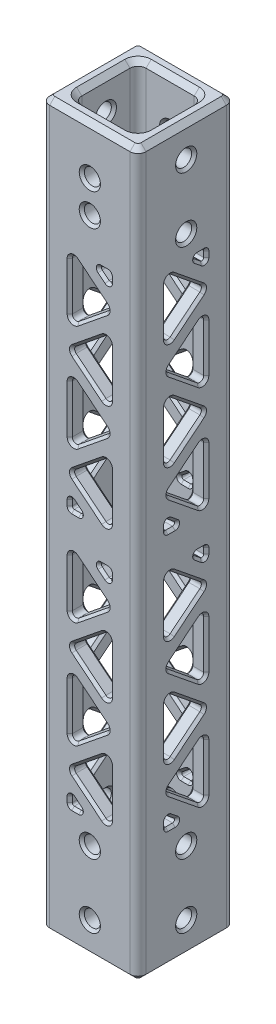
from build123d import *

# Parameters (mm, degrees)
SKETCH1_W                    = 19.05
SKETCH1_H                    = 19.05
SKETCH1_W_2                  = 12.7
SKETCH1_H_2                  = 12.7
BOSS_EXTRUDE1_DEPTH          = 71.4375
F_1_8_0_125_DIAMETER_HOLE1_D = 3.175
F_1_8_0_125_DIAMETER_HOLE2_D = 3.175
F_1_8_0_125_DIAMETER_HOLE3_D = 3.175
CUT_EXTRUDE1_REACH           = 74.696
CIRPATTERN1_COUNT            = 4
FILLET1_R                    = 1.5875
FILLET2_R                    = 0.79375
FILLET3_R                    = 0.396875
CHAMFER1_SIZE                = 1.016
CHAMFER2_SIZE                = 0.508


with BuildPart() as part:
    # Sketch1 → Boss-Extrude1 (new, symmetric)
    with BuildSketch(Plane(origin=(0, 0, 0), x_dir=(1, 0, 0), z_dir=(0, 1, 0))):
        Rectangle(SKETCH1_W, SKETCH1_H)
        Rectangle(SKETCH1_W_2, SKETCH1_H_2, mode=Mode.SUBTRACT)
    extrude(amount=BOSS_EXTRUDE1_DEPTH, both=True)

    # 1/8 (0.125) Diameter Hole1 (through all)
    with Locations(Plane.ZY.offset(9.525)):
        with Locations((0, 65.0875), (0, 52.3875)):
            Hole(F_1_8_0_125_DIAMETER_HOLE1_D / 2)

    # 1/8 (0.125) Diameter Hole2 (through all)
    with Locations(Plane(origin=(9.525, 0, 0), x_dir=(0, 0, -1), z_dir=(1, 0, 0))):
        with Locations((0, -52.3875), (0, -65.0875)):
            Hole(F_1_8_0_125_DIAMETER_HOLE2_D / 2)

    # 1/8 (0.125) Diameter Hole3 (through all)
    with Locations(Plane.XY.offset(9.525)):
        with Locations((0, 61.9125), (0, 55.5625), (0, -65.0875), (0, -52.3875)):
            Hole(F_1_8_0_125_DIAMETER_HOLE3_D / 2)

    # Sketch14 → Cut-Extrude1 (cut, up to next)
    with BuildSketch(Plane(origin=(0, 0, 0), x_dir=(0, 0, -1), z_dir=(1, 0, 0)), mode=Mode.PRIVATE) as cut_extrude1_sk1:
        Polygon((-3.96875, -30.66257637), (3.96875, -24.225305482), (3.96875, -37.099847259), align=None)
    cut_extrude1_tool1 = extrude(cut_extrude1_sk1.sketch, amount=-CUT_EXTRUDE1_REACH, mode=Mode.PRIVATE) & part.part
    # Sketch14 → Cut-Extrude1 (cut, up to next)
    with BuildSketch(Plane(origin=(0, 0, 0), x_dir=(0, 0, -1), z_dir=(1, 0, 0)), mode=Mode.PRIVATE) as cut_extrude1_sk2:
        Polygon((-3.96875, 47.625), (-1.071827407, 47.625), (-3.96875, 45.275610964), align=None)
    cut_extrude1_tool2 = extrude(cut_extrude1_sk2.sketch, amount=-CUT_EXTRUDE1_REACH, mode=Mode.PRIVATE) & part.part
    # Sketch14 → Cut-Extrude1 (cut, up to next)
    with BuildSketch(Plane(origin=(0, 0, 0), x_dir=(0, 0, -1), z_dir=(1, 0, 0)), mode=Mode.PRIVATE) as cut_extrude1_sk3:
        Polygon((3.96875, 47.625), (-3.96875, 41.187729111), (3.96875, 34.750458223), align=None)
    cut_extrude1_tool3 = extrude(cut_extrude1_sk3.sketch, amount=-CUT_EXTRUDE1_REACH, mode=Mode.PRIVATE) & part.part
    # Sketch14 → Cut-Extrude1 (cut, up to next)
    with BuildSketch(Plane(origin=(0, 0, 0), x_dir=(0, 0, -1), z_dir=(1, 0, 0)), mode=Mode.PRIVATE) as cut_extrude1_sk4:
        Polygon((-3.96875, 37.099847259), (3.96875, 30.66257637), (-3.96875, 24.225305482), align=None)
    cut_extrude1_tool4 = extrude(cut_extrude1_sk4.sketch, amount=-CUT_EXTRUDE1_REACH, mode=Mode.PRIVATE) & part.part
    # Sketch14 → Cut-Extrude1 (cut, up to next)
    with BuildSketch(Plane(origin=(0, 0, 0), x_dir=(0, 0, -1), z_dir=(1, 0, 0)), mode=Mode.PRIVATE) as cut_extrude1_sk5:
        Polygon((3.96875, 26.574694518), (-3.96875, 20.13742363), (3.96875, 13.700152741), align=None)
    cut_extrude1_tool5 = extrude(cut_extrude1_sk5.sketch, amount=-CUT_EXTRUDE1_REACH, mode=Mode.PRIVATE) & part.part
    # Sketch14 → Cut-Extrude1 (cut, up to next)
    with BuildSketch(Plane(origin=(0, 0, 0), x_dir=(0, 0, -1), z_dir=(1, 0, 0)), mode=Mode.PRIVATE) as cut_extrude1_sk6:
        Polygon((-3.96875, 3.175), (3.96875, 9.612270889), (-3.96875, 16.049541777), align=None)
    cut_extrude1_tool6 = extrude(cut_extrude1_sk6.sketch, amount=-CUT_EXTRUDE1_REACH, mode=Mode.PRIVATE) & part.part
    # Sketch14 → Cut-Extrude1 (cut, up to next)
    with BuildSketch(Plane(origin=(0, 0, 0), x_dir=(0, 0, -1), z_dir=(1, 0, 0)), mode=Mode.PRIVATE) as cut_extrude1_sk7:
        Polygon((1.071827407, 3.175), (3.96875, 3.175), (3.96875, 5.524389036), align=None)
    cut_extrude1_tool7 = extrude(cut_extrude1_sk7.sketch, amount=-CUT_EXTRUDE1_REACH, mode=Mode.PRIVATE) & part.part
    # Sketch14 → Cut-Extrude1 (cut, up to next)
    with BuildSketch(Plane(origin=(0, 0, 0), x_dir=(0, 0, -1), z_dir=(1, 0, 0)), mode=Mode.PRIVATE) as cut_extrude1_sk8:
        Polygon((-1.071827407, -3.175), (-3.96875, -3.175), (-3.96875, -5.524389036), align=None)
    cut_extrude1_tool8 = extrude(cut_extrude1_sk8.sketch, amount=-CUT_EXTRUDE1_REACH, mode=Mode.PRIVATE) & part.part
    # Sketch14 → Cut-Extrude1 (cut, up to next)
    with BuildSketch(Plane(origin=(0, 0, 0), x_dir=(0, 0, -1), z_dir=(1, 0, 0)), mode=Mode.PRIVATE) as cut_extrude1_sk9:
        Polygon((3.96875, -3.175), (-3.96875, -9.612270889), (3.96875, -16.049541777), align=None)
    cut_extrude1_tool9 = extrude(cut_extrude1_sk9.sketch, amount=-CUT_EXTRUDE1_REACH, mode=Mode.PRIVATE) & part.part
    # Sketch14 → Cut-Extrude1 (cut, up to next)
    with BuildSketch(Plane(origin=(0, 0, 0), x_dir=(0, 0, -1), z_dir=(1, 0, 0)), mode=Mode.PRIVATE) as cut_extrude1_sk10:
        Polygon((-3.96875, -13.700152741), (3.96875, -20.13742363), (-3.96875, -26.574694518), align=None)
    cut_extrude1_tool10 = extrude(cut_extrude1_sk10.sketch, amount=-CUT_EXTRUDE1_REACH, mode=Mode.PRIVATE) & part.part
    # Sketch14 → Cut-Extrude1 (cut, up to next)
    with BuildSketch(Plane(origin=(0, 0, 0), x_dir=(0, 0, -1), z_dir=(1, 0, 0)), mode=Mode.PRIVATE) as cut_extrude1_sk11:
        Polygon((-3.96875, -47.625), (3.96875, -41.187729111), (-3.96875, -34.750458223), align=None)
    cut_extrude1_tool11 = extrude(cut_extrude1_sk11.sketch, amount=-CUT_EXTRUDE1_REACH, mode=Mode.PRIVATE) & part.part
    # Sketch14 → Cut-Extrude1 (cut, up to next)
    with BuildSketch(Plane(origin=(0, 0, 0), x_dir=(0, 0, -1), z_dir=(1, 0, 0)), mode=Mode.PRIVATE) as cut_extrude1_sk12:
        Polygon((1.071827407, -47.625), (3.96875, -47.625), (3.96875, -45.275610964), align=None)
    cut_extrude1_tool12 = extrude(cut_extrude1_sk12.sketch, amount=-CUT_EXTRUDE1_REACH, mode=Mode.PRIVATE) & part.part
    cut_extrude1_1 = cut_extrude1_tool1.solids().sort_by_distance((0, -30.662576, -1.322917))[0]
    add(cut_extrude1_1, mode=Mode.SUBTRACT)
    cut_extrude1_2 = cut_extrude1_tool2.solids().sort_by_distance((0, 46.84187, 3.003109))[0]
    add(cut_extrude1_2, mode=Mode.SUBTRACT)
    cut_extrude1_3 = cut_extrude1_tool3.solids().sort_by_distance((0, 41.187729, -1.322917))[0]
    add(cut_extrude1_3, mode=Mode.SUBTRACT)
    cut_extrude1_4 = cut_extrude1_tool4.solids().sort_by_distance((0, 30.662576, 1.322917))[0]
    add(cut_extrude1_4, mode=Mode.SUBTRACT)
    cut_extrude1_5 = cut_extrude1_tool5.solids().sort_by_distance((0, 20.137424, -1.322917))[0]
    add(cut_extrude1_5, mode=Mode.SUBTRACT)
    cut_extrude1_6 = cut_extrude1_tool6.solids().sort_by_distance((0, 9.612271, 1.322917))[0]
    add(cut_extrude1_6, mode=Mode.SUBTRACT)
    cut_extrude1_7 = cut_extrude1_tool7.solids().sort_by_distance((0, 3.95813, -3.003109))[0]
    add(cut_extrude1_7, mode=Mode.SUBTRACT)
    cut_extrude1_8 = cut_extrude1_tool8.solids().sort_by_distance((0, -3.95813, 3.003109))[0]
    add(cut_extrude1_8, mode=Mode.SUBTRACT)
    cut_extrude1_9 = cut_extrude1_tool9.solids().sort_by_distance((0, -9.612271, -1.322917))[0]
    add(cut_extrude1_9, mode=Mode.SUBTRACT)
    cut_extrude1_10 = cut_extrude1_tool10.solids().sort_by_distance((0, -20.137424, 1.322917))[0]
    add(cut_extrude1_10, mode=Mode.SUBTRACT)
    cut_extrude1_11 = cut_extrude1_tool11.solids().sort_by_distance((0, -41.187729, 1.322917))[0]
    add(cut_extrude1_11, mode=Mode.SUBTRACT)
    cut_extrude1_12 = cut_extrude1_tool12.solids().sort_by_distance((0, -46.84187, -3.003109))[0]
    add(cut_extrude1_12, mode=Mode.SUBTRACT)
    cut_extrude1 = cut_extrude1_1 + cut_extrude1_2 + cut_extrude1_3 + cut_extrude1_4 + cut_extrude1_5 + cut_extrude1_6 + cut_extrude1_7 + cut_extrude1_8 + cut_extrude1_9 + cut_extrude1_10 + cut_extrude1_11 + cut_extrude1_12  # Cut-Extrude1 as one shape, for the pattern or mirror that repeats it

    # CirPattern1: Cut-Extrude1 ×4 about axis
    cirpattern1_axis = Axis((0, 0, 0), (0, 1, 0))
    for i in range(1, CIRPATTERN1_COUNT):
        add(cut_extrude1.rotate(cirpattern1_axis, i * 360 / CIRPATTERN1_COUNT), mode=Mode.SUBTRACT)

    # Fillet1
    fillet1_edges = [part.edges().sort_by_distance(p)[0] for p in [
        (6.35, 0, 6.35),
        (6.35, 0, -6.35),
        (-6.35, 0, -6.35),
        (-6.35, 0, 6.35),
        (9.525, 0, 9.525),
        (-9.525, 0, 9.525),
        (-9.525, 0, -9.525),
        (9.525, 0, -9.525),
    ]]
    fillet(fillet1_edges, radius=FILLET1_R)

    # Fillet2
    fillet2_edges = [part.edges().sort_by_distance(p)[0] for p in [
        (-7.9375, -3.175, -3.96875),
        (-7.9375, -16.049541777, -3.96875),
        (-7.9375, -9.612270889, 3.96875),
        (-7.9375, 3.175, 3.96875),
        (-7.9375, 16.049541777, 3.96875),
        (-7.9375, 9.612270889, -3.96875),
        (-7.9375, 47.625, -3.96875),
        (-7.9375, 34.750458223, -3.96875),
        (-7.9375, 41.187729111, 3.96875),
        (-7.9375, -37.099847259, -3.96875),
        (-7.9375, -30.66257637, 3.96875),
        (-7.9375, -24.225305482, -3.96875),
        (-7.9375, -47.625, 3.96875),
        (-7.9375, -34.750458223, 3.96875),
        (-7.9375, -41.187729111, -3.96875),
        (-7.9375, 26.574694518, -3.96875),
        (-7.9375, 13.700152741, -3.96875),
        (-7.9375, 20.13742363, 3.96875),
        (-7.9375, 24.225305482, 3.96875),
        (-7.9375, 37.099847259, 3.96875),
        (-7.9375, 30.66257637, -3.96875),
        (-7.9375, -26.574694518, 3.96875),
        (-7.9375, -13.700152741, 3.96875),
        (-7.9375, -20.13742363, -3.96875),
        (7.9375, 26.574694518, 3.96875),
        (7.9375, 13.700152741, 3.96875),
        (7.9375, 20.13742363, -3.96875),
        (7.9375, 24.225305482, -3.96875),
        (7.9375, 37.099847259, -3.96875),
        (7.9375, 30.66257637, 3.96875),
        (7.9375, -26.574694518, -3.96875),
        (7.9375, -13.700152741, -3.96875),
        (7.9375, -20.13742363, 3.96875),
        (7.9375, -3.175, 3.96875),
        (7.9375, -16.049541777, 3.96875),
        (7.9375, -9.612270889, -3.96875),
        (7.9375, 3.175, -3.96875),
        (7.9375, 16.049541777, -3.96875),
        (7.9375, 9.612270889, 3.96875),
        (3.96875, -3.175, -7.9375),
        (3.96875, -16.049541777, -7.9375),
        (-3.96875, -9.612270889, -7.9375),
        (-3.96875, 3.175, -7.9375),
        (-3.96875, 16.049541777, -7.9375),
        (3.96875, 9.612270889, -7.9375),
        (3.96875, 47.625, -7.9375),
        (3.96875, 34.750458223, -7.9375),
        (-3.96875, 41.187729111, -7.9375),
        (3.96875, -37.099847259, -7.9375),
        (-3.96875, -30.66257637, -7.9375),
        (3.96875, -24.225305482, -7.9375),
        (-3.96875, -47.625, -7.9375),
        (-3.96875, -34.750458223, -7.9375),
        (3.96875, -41.187729111, -7.9375),
        (-3.96875, -3.175, 7.9375),
        (-3.96875, -16.049541777, 7.9375),
        (3.96875, -9.612270889, 7.9375),
        (3.96875, 3.175, 7.9375),
        (3.96875, 16.049541777, 7.9375),
        (-3.96875, 9.612270889, 7.9375),
        (-3.96875, 47.625, 7.9375),
        (-3.96875, 34.750458223, 7.9375),
        (3.96875, 41.187729111, 7.9375),
        (-3.96875, -37.099847259, 7.9375),
        (3.96875, -30.66257637, 7.9375),
        (-3.96875, -24.225305482, 7.9375),
        (3.96875, -47.625, 7.9375),
        (3.96875, -34.750458223, 7.9375),
        (-3.96875, -41.187729111, 7.9375),
        (7.9375, 47.625, 3.96875),
        (7.9375, 34.750458223, 3.96875),
        (7.9375, 41.187729111, -3.96875),
        (7.9375, -37.099847259, 3.96875),
        (7.9375, -30.66257637, -3.96875),
        (7.9375, -24.225305482, 3.96875),
        (7.9375, -47.625, -3.96875),
        (7.9375, -34.750458223, -3.96875),
        (7.9375, -41.187729111, 3.96875),
        (-3.96875, 26.574694518, 7.9375),
        (-3.96875, 13.700152741, 7.9375),
        (3.96875, 20.13742363, 7.9375),
        (3.96875, 24.225305482, 7.9375),
        (3.96875, 37.099847259, 7.9375),
        (-3.96875, 30.66257637, 7.9375),
        (3.96875, -26.574694518, 7.9375),
        (3.96875, -13.700152741, 7.9375),
        (-3.96875, -20.13742363, 7.9375),
        (3.96875, 26.574694518, -7.9375),
        (3.96875, 13.700152741, -7.9375),
        (-3.96875, 20.13742363, -7.9375),
        (-3.96875, 24.225305482, -7.9375),
        (-3.96875, 37.099847259, -7.9375),
        (3.96875, 30.66257637, -7.9375),
        (-3.96875, -26.574694518, -7.9375),
        (-3.96875, -13.700152741, -7.9375),
        (3.96875, -20.13742363, -7.9375),
    ]]
    fillet(fillet2_edges, radius=FILLET2_R)

    # Fillet3
    fillet3_edges = [part.edges().sort_by_distance(p)[0] for p in [
        (-7.9375, -5.524389036, 3.96875),
        (-7.9375, -3.175, 3.96875),
        (-7.9375, -3.175, 1.071827407),
        (-7.9375, 5.524389036, -3.96875),
        (-7.9375, 3.175, -3.96875),
        (-7.9375, 3.175, -1.071827407),
        (-7.9375, -45.275610964, -3.96875),
        (-7.9375, -47.625, -3.96875),
        (-7.9375, -47.625, -1.071827407),
        (-7.9375, 45.275610964, 3.96875),
        (-7.9375, 47.625, 3.96875),
        (-7.9375, 47.625, 1.071827407),
        (-3.96875, 45.275610964, -7.9375),
        (-3.96875, 47.625, -7.9375),
        (-1.071827407, 47.625, -7.9375),
        (7.9375, -5.524389036, -3.96875),
        (7.9375, -3.175, -3.96875),
        (7.9375, -3.175, -1.071827407),
        (7.9375, 5.524389036, 3.96875),
        (7.9375, 3.175, 3.96875),
        (7.9375, 3.175, 1.071827407),
        (-3.96875, -5.524389036, -7.9375),
        (-3.96875, -3.175, -7.9375),
        (-1.071827407, -3.175, -7.9375),
        (3.96875, 5.524389036, -7.9375),
        (3.96875, 3.175, -7.9375),
        (1.071827407, 3.175, -7.9375),
        (3.96875, -45.275610964, -7.9375),
        (3.96875, -47.625, -7.9375),
        (1.071827407, -47.625, -7.9375),
        (3.96875, -5.524389036, 7.9375),
        (3.96875, -3.175, 7.9375),
        (1.071827407, -3.175, 7.9375),
        (-3.96875, 5.524389036, 7.9375),
        (-3.96875, 3.175, 7.9375),
        (-1.071827407, 3.175, 7.9375),
        (-3.96875, -45.275610964, 7.9375),
        (-3.96875, -47.625, 7.9375),
        (-1.071827407, -47.625, 7.9375),
        (7.9375, -45.275610964, 3.96875),
        (7.9375, -47.625, 3.96875),
        (7.9375, -47.625, 1.071827407),
        (7.9375, 45.275610964, -3.96875),
        (7.9375, 47.625, -3.96875),
        (7.9375, 47.625, -1.071827407),
        (3.96875, 45.275610964, 7.9375),
        (3.96875, 47.625, 7.9375),
        (1.071827407, 47.625, 7.9375),
    ]]
    fillet(fillet3_edges, radius=FILLET3_R)

    # Chamfer1
    chamfer1_edges = [part.edges().sort_by_distance(p)[0] for p in [
        (0, -71.4375, -9.525),
        (0, 71.4375, -9.525),
        (9.525, -71.4375, 0),
        (0, -71.4375, 9.525),
        (-9.525, -71.4375, 0),
        (0, -71.4375, 6.35),
        (6.35, -71.4375, 0),
        (0, -71.4375, -6.35),
        (-6.35, -71.4375, 0),
        (-9.060032015, -71.4375, 9.060032015),
        (-9.060032015, -71.4375, -9.060032015),
        (9.060032015, -71.4375, 9.060032015),
        (9.060032015, -71.4375, -9.060032015),
        (9.525, 71.4375, 0),
        (-9.525, 71.4375, 0),
        (0, 71.4375, 9.525),
        (6.35, 71.4375, 0),
        (0, 71.4375, 6.35),
        (-6.35, 71.4375, 0),
        (0, 71.4375, -6.35),
        (-9.060032015, 71.4375, 9.060032015),
        (-9.060032015, 71.4375, -9.060032015),
        (9.060032015, 71.4375, 9.060032015),
        (9.060032015, 71.4375, -9.060032015),
        (5.885032015, -71.4375, -5.885032015),
        (5.885032015, 71.4375, -5.885032015),
        (5.885032015, -71.4375, 5.885032015),
        (5.885032015, 71.4375, 5.885032015),
        (-5.885032015, -71.4375, 5.885032015),
        (-5.885032015, 71.4375, 5.885032015),
        (-5.885032015, -71.4375, -5.885032015),
        (-5.885032015, 71.4375, -5.885032015),
    ]]
    chamfer(chamfer1_edges, length=CHAMFER1_SIZE)

    # Chamfer2
    chamfer2_edges = [part.edges().sort_by_distance(p)[0] for p in [
        (2.881571364, 47.625, 9.525),
        (2.881571364, 47.625, 6.35),
        (2.631584503, 46.360045172, 9.525),
        (2.631584503, 46.360045172, 6.35),
        (3.96875, 46.66829237, 9.525),
        (3.96875, 46.66829237, 6.35),
        (-2.881571364, 3.175, 9.525),
        (-2.881571364, 3.175, 6.35),
        (-2.631584503, 4.439954828, 9.525),
        (-2.631584503, 4.439954828, 6.35),
        (-3.96875, 4.13170763, 9.525),
        (-3.96875, 4.13170763, 6.35),
        (2.881571364, -3.175, 9.525),
        (2.881571364, -3.175, 6.35),
        (2.631584503, -4.439954828, 9.525),
        (2.631584503, -4.439954828, 6.35),
        (3.96875, -4.13170763, 9.525),
        (3.96875, -4.13170763, 6.35),
        (-2.881571364, -47.625, 9.525),
        (-2.881571364, -47.625, 6.35),
        (-2.631584503, -46.360045172, 9.525),
        (-2.631584503, -46.360045172, 6.35),
        (-3.96875, -46.66829237, 9.525),
        (-3.96875, -46.66829237, 6.35),
        (9.525, -47.625, 2.881571364),
        (6.35, -47.625, 2.881571364),
        (9.525, -46.360045172, 2.631584503),
        (6.35, -46.360045172, 2.631584503),
        (9.525, -46.66829237, 3.96875),
        (6.35, -46.66829237, 3.96875),
        (9.525, -3.175, -2.881571364),
        (6.35, -3.175, -2.881571364),
        (9.525, -4.439954828, -2.631584503),
        (6.35, -4.439954828, -2.631584503),
        (9.525, -4.13170763, -3.96875),
        (6.35, -4.13170763, -3.96875),
        (9.525, 3.175, 2.881571364),
        (6.35, 3.175, 2.881571364),
        (9.525, 4.439954828, 2.631584503),
        (6.35, 4.439954828, 2.631584503),
        (9.525, 4.13170763, 3.96875),
        (6.35, 4.13170763, 3.96875),
        (9.525, 47.625, -2.881571364),
        (6.35, 47.625, -2.881571364),
        (9.525, 46.360045172, -2.631584503),
        (6.35, 46.360045172, -2.631584503),
        (9.525, 46.66829237, -3.96875),
        (6.35, 46.66829237, -3.96875),
        (-9.525, 46.360045172, 2.631584503),
        (-6.35, 46.360045172, 2.631584503),
        (-9.525, 46.66829237, 3.96875),
        (-6.35, 46.66829237, 3.96875),
        (-9.525, 47.625, 2.881571364),
        (-6.35, 47.625, 2.881571364),
        (-9.525, 3.175, -2.881571364),
        (-6.35, 3.175, -2.881571364),
        (-9.525, 4.439954828, -2.631584503),
        (-6.35, 4.439954828, -2.631584503),
        (-9.525, 4.13170763, -3.96875),
        (-6.35, 4.13170763, -3.96875),
        (-9.525, -4.439954828, 2.631584503),
        (-6.35, -4.439954828, 2.631584503),
        (-9.525, -4.13170763, 3.96875),
        (-6.35, -4.13170763, 3.96875),
        (-9.525, -3.175, 2.881571364),
        (-6.35, -3.175, 2.881571364),
        (-9.525, -47.625, -2.881571364),
        (-6.35, -47.625, -2.881571364),
        (-9.525, -46.360045172, -2.631584503),
        (-6.35, -46.360045172, -2.631584503),
        (-9.525, -46.66829237, -3.96875),
        (-6.35, -46.66829237, -3.96875),
        (2.881571364, -47.625, -9.525),
        (2.881571364, -47.625, -6.35),
        (2.631584503, -46.360045172, -9.525),
        (2.631584503, -46.360045172, -6.35),
        (3.96875, -46.66829237, -9.525),
        (3.96875, -46.66829237, -6.35),
        (-2.631584503, -4.439954828, -9.525),
        (-2.631584503, -4.439954828, -6.35),
        (-3.96875, -4.13170763, -9.525),
        (-3.96875, -4.13170763, -6.35),
        (-2.881571364, -3.175, -9.525),
        (-2.881571364, -3.175, -6.35),
        (2.881571364, 3.175, -9.525),
        (2.881571364, 3.175, -6.35),
        (2.631584503, 4.439954828, -9.525),
        (2.631584503, 4.439954828, -6.35),
        (3.96875, 4.13170763, -9.525),
        (3.96875, 4.13170763, -6.35),
        (-2.631584503, 46.360045172, -9.525),
        (-2.631584503, 46.360045172, -6.35),
        (-3.96875, 46.66829237, -9.525),
        (-3.96875, 46.66829237, -6.35),
        (-2.881571364, 47.625, -9.525),
        (-2.881571364, 47.625, -6.35),
        (1.817205318, 47.360741287, 6.35),
        (1.817205318, 47.360741287, 9.525),
        (3.74260319, 45.750183798, 6.35),
        (3.74260319, 45.750183798, 9.525),
        (3.852508004, 47.508758004, 6.35),
        (3.852508004, 47.508758004, 9.525),
        (-1.817205318, 3.439258713, 6.35),
        (-1.817205318, 3.439258713, 9.525),
        (-3.74260319, 5.049816202, 6.35),
        (-3.74260319, 5.049816202, 9.525),
        (-3.852508004, 3.291241996, 6.35),
        (-3.852508004, 3.291241996, 9.525),
        (1.817205318, -3.439258713, 6.35),
        (1.817205318, -3.439258713, 9.525),
        (3.74260319, -5.049816202, 6.35),
        (3.74260319, -5.049816202, 9.525),
        (3.852508004, -3.291241996, 6.35),
        (3.852508004, -3.291241996, 9.525),
        (-1.817205318, -47.360741287, 6.35),
        (-1.817205318, -47.360741287, 9.525),
        (-3.74260319, -45.750183798, 6.35),
        (-3.74260319, -45.750183798, 9.525),
        (-3.852508004, -47.508758004, 6.35),
        (-3.852508004, -47.508758004, 9.525),
        (6.35, -47.360741287, 1.817205318),
        (9.525, -47.360741287, 1.817205318),
        (6.35, -45.750183798, 3.74260319),
        (9.525, -45.750183798, 3.74260319),
        (6.35, -47.508758004, 3.852508004),
        (9.525, -47.508758004, 3.852508004),
        (6.35, -3.439258713, -1.817205318),
        (9.525, -3.439258713, -1.817205318),
        (6.35, -3.291241996, -3.852508004),
        (9.525, -3.291241996, -3.852508004),
        (6.35, -5.049816202, -3.74260319),
        (9.525, -5.049816202, -3.74260319),
        (6.35, 3.439258713, 1.817205318),
        (9.525, 3.439258713, 1.817205318),
        (6.35, 5.049816202, 3.74260319),
        (9.525, 5.049816202, 3.74260319),
        (6.35, 3.291241996, 3.852508004),
        (9.525, 3.291241996, 3.852508004),
        (6.35, 47.360741287, -1.817205318),
        (9.525, 47.360741287, -1.817205318),
        (6.35, 45.750183798, -3.74260319),
        (9.525, 45.750183798, -3.74260319),
        (6.35, 47.508758004, -3.852508004),
        (9.525, 47.508758004, -3.852508004),
        (-6.35, 45.750183798, 3.74260319),
        (-9.525, 45.750183798, 3.74260319),
        (-6.35, 47.508758004, 3.852508004),
        (-9.525, 47.508758004, 3.852508004),
        (-6.35, 47.360741287, 1.817205318),
        (-9.525, 47.360741287, 1.817205318),
        (-6.35, 3.439258713, -1.817205318),
        (-9.525, 3.439258713, -1.817205318),
        (-6.35, 5.049816202, -3.74260319),
        (-9.525, 5.049816202, -3.74260319),
        (-6.35, 3.291241996, -3.852508004),
        (-9.525, 3.291241996, -3.852508004),
        (-6.35, -5.049816202, 3.74260319),
        (-9.525, -5.049816202, 3.74260319),
        (-6.35, -3.291241996, 3.852508004),
        (-9.525, -3.291241996, 3.852508004),
        (-6.35, -3.439258713, 1.817205318),
        (-9.525, -3.439258713, 1.817205318),
        (-6.35, -47.360741287, -1.817205318),
        (-9.525, -47.360741287, -1.817205318),
        (-6.35, -45.750183798, -3.74260319),
        (-9.525, -45.750183798, -3.74260319),
        (-6.35, -47.508758004, -3.852508004),
        (-9.525, -47.508758004, -3.852508004),
        (1.817205318, -47.360741287, -6.35),
        (1.817205318, -47.360741287, -9.525),
        (3.74260319, -45.750183798, -6.35),
        (3.74260319, -45.750183798, -9.525),
        (3.852508004, -47.508758004, -6.35),
        (3.852508004, -47.508758004, -9.525),
        (-3.74260319, -5.049816202, -6.35),
        (-3.74260319, -5.049816202, -9.525),
        (-3.852508004, -3.291241996, -6.35),
        (-3.852508004, -3.291241996, -9.525),
        (-1.817205318, -3.439258713, -6.35),
        (-1.817205318, -3.439258713, -9.525),
        (1.817205318, 3.439258713, -6.35),
        (1.817205318, 3.439258713, -9.525),
        (3.74260319, 5.049816202, -6.35),
        (3.74260319, 5.049816202, -9.525),
        (3.852508004, 3.291241996, -6.35),
        (3.852508004, 3.291241996, -9.525),
        (-3.74260319, 45.750183798, -6.35),
        (-3.74260319, 45.750183798, -9.525),
        (-3.852508004, 47.508758004, -6.35),
        (-3.852508004, 47.508758004, -9.525),
        (-1.817205318, 47.360741287, -6.35),
        (-1.817205318, 47.360741287, -9.525),
        (6.35, 52.3875, 1.5875),
        (-6.35, 52.3875, 1.5875),
        (-9.525, 52.3875, 1.5875),
        (9.525, 52.3875, 1.5875),
        (-6.35, 65.0875, 1.5875),
        (6.35, 65.0875, 1.5875),
        (9.525, 65.0875, 1.5875),
        (-9.525, 65.0875, 1.5875),
        (6.35, -65.0875, -1.5875),
        (-6.35, -65.0875, -1.5875),
        (-9.525, -65.0875, -1.5875),
        (9.525, -65.0875, -1.5875),
        (6.35, -52.3875, -1.5875),
        (-6.35, -52.3875, -1.5875),
        (-9.525, -52.3875, -1.5875),
        (9.525, -52.3875, -1.5875),
        (-0.266776547, 38.185448048, -9.525),
        (-0.266776547, 38.185448048, -6.35),
        (-0.266776547, 44.190010175, -9.525),
        (-0.266776547, 44.190010175, -6.35),
        (3.96875, 41.187729111, -9.525),
        (3.96875, 41.187729111, -6.35),
        (0.266776547, 33.664857434, -9.525),
        (0.266776547, 33.664857434, -6.35),
        (0.266776547, 27.660295307, -9.525),
        (0.266776547, 27.660295307, -6.35),
        (-3.96875, 30.66257637, -9.525),
        (-3.96875, 30.66257637, -6.35),
        (-0.266776547, 17.135142566, -9.525),
        (-0.266776547, 17.135142566, -6.35),
        (-0.266776547, 23.139704693, -9.525),
        (-0.266776547, 23.139704693, -6.35),
        (3.96875, 20.13742363, -9.525),
        (3.96875, 20.13742363, -6.35),
        (0.266776547, 12.614551952, -9.525),
        (0.266776547, 12.614551952, -6.35),
        (0.266776547, 6.609989825, -9.525),
        (0.266776547, 6.609989825, -6.35),
        (-3.96875, 9.612270889, -9.525),
        (-3.96875, 9.612270889, -6.35),
        (-0.266776547, -12.614551952, -9.525),
        (-0.266776547, -12.614551952, -6.35),
        (-0.266776547, -6.609989825, -9.525),
        (-0.266776547, -6.609989825, -6.35),
        (3.96875, -9.612270889, -9.525),
        (3.96875, -9.612270889, -6.35),
        (0.266776547, -23.139704693, -9.525),
        (0.266776547, -23.139704693, -6.35),
        (-3.96875, -20.13742363, -9.525),
        (-3.96875, -20.13742363, -6.35),
        (0.266776547, -17.135142566, -9.525),
        (0.266776547, -17.135142566, -6.35),
        (-0.266776547, -27.660295307, -9.525),
        (-0.266776547, -27.660295307, -6.35),
        (3.96875, -30.66257637, -9.525),
        (3.96875, -30.66257637, -6.35),
        (-0.266776547, -33.664857434, -9.525),
        (-0.266776547, -33.664857434, -6.35),
        (0.266776547, -38.185448048, -9.525),
        (0.266776547, -38.185448048, -6.35),
        (0.266776547, -44.190010175, -9.525),
        (0.266776547, -44.190010175, -6.35),
        (-3.96875, -41.187729111, -9.525),
        (-3.96875, -41.187729111, -6.35),
        (-9.525, -44.190010175, -0.266776547),
        (-6.35, -44.190010175, -0.266776547),
        (-9.525, -41.187729111, 3.96875),
        (-6.35, -41.187729111, 3.96875),
        (-9.525, -38.185448048, -0.266776547),
        (-6.35, -38.185448048, -0.266776547),
        (-9.525, -27.660295307, 0.266776547),
        (-6.35, -27.660295307, 0.266776547),
        (-9.525, -30.66257637, -3.96875),
        (-6.35, -30.66257637, -3.96875),
        (-9.525, -33.664857434, 0.266776547),
        (-6.35, -33.664857434, 0.266776547),
        (-9.525, -23.139704693, -0.266776547),
        (-6.35, -23.139704693, -0.266776547),
        (-9.525, -20.13742363, 3.96875),
        (-6.35, -20.13742363, 3.96875),
        (-9.525, -17.135142566, -0.266776547),
        (-6.35, -17.135142566, -0.266776547),
        (1.5875, -52.3875, -6.35),
        (1.5875, -52.3875, 6.35),
        (-9.525, -12.614551952, 0.266776547),
        (-6.35, -12.614551952, 0.266776547),
        (1.5875, -52.3875, 9.525),
        (1.5875, -52.3875, -9.525),
        (-9.525, -6.609989825, 0.266776547),
        (-6.35, -6.609989825, 0.266776547),
        (-9.525, -9.612270889, -3.96875),
        (-6.35, -9.612270889, -3.96875),
        (-9.525, 6.609989825, -0.266776547),
        (-6.35, 6.609989825, -0.266776547),
        (-9.525, 9.612270889, 3.96875),
        (-6.35, 9.612270889, 3.96875),
        (-9.525, 12.614551952, -0.266776547),
        (-6.35, 12.614551952, -0.266776547),
        (-9.525, 17.135142566, 0.266776547),
        (-6.35, 17.135142566, 0.266776547),
        (-9.525, 23.139704693, 0.266776547),
        (-6.35, 23.139704693, 0.266776547),
        (-9.525, 20.13742363, -3.96875),
        (-6.35, 20.13742363, -3.96875),
        (-9.525, 27.660295307, -0.266776547),
        (-6.35, 27.660295307, -0.266776547),
        (-9.525, 30.66257637, 3.96875),
        (-6.35, 30.66257637, 3.96875),
        (-9.525, 33.664857434, -0.266776547),
        (-6.35, 33.664857434, -0.266776547),
        (-9.525, 38.185448048, 0.266776547),
        (-6.35, 38.185448048, 0.266776547),
        (-9.525, 44.190010175, 0.266776547),
        (-6.35, 44.190010175, 0.266776547),
        (-9.525, 41.187729111, -3.96875),
        (-6.35, 41.187729111, -3.96875),
        (0.266776547, 44.190010175, 9.525),
        (0.266776547, 44.190010175, 6.35),
        (-3.96875, 41.187729111, 9.525),
        (-3.96875, 41.187729111, 6.35),
        (0.266776547, 38.185448048, 9.525),
        (0.266776547, 38.185448048, 6.35),
        (-0.266776547, 33.664857434, 9.525),
        (-0.266776547, 33.664857434, 6.35),
        (-0.266776547, 27.660295307, 9.525),
        (-0.266776547, 27.660295307, 6.35),
        (3.96875, 30.66257637, 9.525),
        (3.96875, 30.66257637, 6.35),
        (0.266776547, 23.139704693, 9.525),
        (0.266776547, 23.139704693, 6.35),
        (-3.96875, 20.13742363, 9.525),
        (-3.96875, 20.13742363, 6.35),
        (0.266776547, 17.135142566, 9.525),
        (0.266776547, 17.135142566, 6.35),
        (-0.266776547, 12.614551952, 9.525),
        (-0.266776547, 12.614551952, 6.35),
        (-0.266776547, 6.609989825, 9.525),
        (-0.266776547, 6.609989825, 6.35),
        (3.96875, 9.612270889, 9.525),
        (3.96875, 9.612270889, 6.35),
        (0.266776547, -6.609989825, 9.525),
        (0.266776547, -6.609989825, 6.35),
        (-3.96875, -9.612270889, 9.525),
        (-3.96875, -9.612270889, 6.35),
        (0.266776547, -12.614551952, 9.525),
        (0.266776547, -12.614551952, 6.35),
        (-0.266776547, -17.135142566, 9.525),
        (-0.266776547, -17.135142566, 6.35),
        (-0.266776547, -23.139704693, 9.525),
        (-0.266776547, -23.139704693, 6.35),
        (3.96875, -20.13742363, 9.525),
        (3.96875, -20.13742363, 6.35),
        (0.266776547, -27.660295307, 9.525),
        (0.266776547, -27.660295307, 6.35),
        (-3.96875, -30.66257637, 9.525),
        (-3.96875, -30.66257637, 6.35),
        (0.266776547, -33.664857434, 9.525),
        (0.266776547, -33.664857434, 6.35),
        (-0.266776547, -38.185448048, 9.525),
        (-0.266776547, -38.185448048, 6.35),
        (-0.266776547, -44.190010175, 9.525),
        (-0.266776547, -44.190010175, 6.35),
        (3.96875, -41.187729111, 9.525),
        (3.96875, -41.187729111, 6.35),
        (1.5875, -65.0875, -6.35),
        (1.5875, -65.0875, 6.35),
        (9.525, -38.185448048, 0.266776547),
        (6.35, -38.185448048, 0.266776547),
        (1.5875, -65.0875, 9.525),
        (1.5875, -65.0875, -9.525),
        (9.525, -44.190010175, 0.266776547),
        (6.35, -44.190010175, 0.266776547),
        (9.525, -41.187729111, -3.96875),
        (6.35, -41.187729111, -3.96875),
        (9.525, -27.660295307, -0.266776547),
        (6.35, -27.660295307, -0.266776547),
        (9.525, -30.66257637, 3.96875),
        (6.35, -30.66257637, 3.96875),
        (9.525, -33.664857434, -0.266776547),
        (6.35, -33.664857434, -0.266776547),
        (9.525, -23.139704693, 0.266776547),
        (6.35, -23.139704693, 0.266776547),
        (9.525, -20.13742363, -3.96875),
        (6.35, -20.13742363, -3.96875),
        (9.525, -17.135142566, 0.266776547),
        (6.35, -17.135142566, 0.266776547),
        (9.525, -6.609989825, -0.266776547),
        (6.35, -6.609989825, -0.266776547),
        (9.525, -9.612270889, 3.96875),
        (6.35, -9.612270889, 3.96875),
        (9.525, -12.614551952, -0.266776547),
        (6.35, -12.614551952, -0.266776547),
        (9.525, 6.609989825, 0.266776547),
        (6.35, 6.609989825, 0.266776547),
        (9.525, 9.612270889, -3.96875),
        (6.35, 9.612270889, -3.96875),
        (9.525, 12.614551952, 0.266776547),
        (6.35, 12.614551952, 0.266776547),
        (9.525, 23.139704693, -0.266776547),
        (6.35, 23.139704693, -0.266776547),
        (9.525, 20.13742363, 3.96875),
        (6.35, 20.13742363, 3.96875),
        (9.525, 17.135142566, -0.266776547),
        (6.35, 17.135142566, -0.266776547),
        (9.525, 27.660295307, 0.266776547),
        (6.35, 27.660295307, 0.266776547),
        (9.525, 30.66257637, -3.96875),
        (6.35, 30.66257637, -3.96875),
        (9.525, 33.664857434, 0.266776547),
        (6.35, 33.664857434, 0.266776547),
        (9.525, 38.185448048, -0.266776547),
        (6.35, 38.185448048, -0.266776547),
        (9.525, 44.190010175, -0.266776547),
        (6.35, 44.190010175, -0.266776547),
        (9.525, 41.187729111, 3.96875),
        (6.35, 41.187729111, 3.96875),
        (-3.502355648, 41.187729111, -6.35),
        (-3.502355648, 41.187729111, -9.525),
        (3.516456381, 46.675854332, -6.35),
        (3.516456381, 46.675854332, -9.525),
        (3.516456381, 35.699603891, -6.35),
        (3.516456381, 35.699603891, -9.525),
        (3.502355648, 30.66257637, -6.35),
        (3.502355648, 30.66257637, -9.525),
        (-3.516456381, 36.150701591, -6.35),
        (-3.516456381, 36.150701591, -9.525),
        (-3.516456381, 25.17445115, -6.35),
        (-3.516456381, 25.17445115, -9.525),
        (-3.502355648, 20.13742363, -6.35),
        (-3.502355648, 20.13742363, -9.525),
        (3.516456381, 25.62554885, -6.35),
        (3.516456381, 25.62554885, -9.525),
        (3.516456381, 14.649298409, -6.35),
        (3.516456381, 14.649298409, -9.525),
        (3.502355648, 9.612270889, -6.35),
        (3.502355648, 9.612270889, -9.525),
        (-3.516456381, 15.100396109, -6.35),
        (-3.516456381, 15.100396109, -9.525),
        (-3.516456381, 4.124145668, -6.35),
        (-3.516456381, 4.124145668, -9.525),
        (-3.502355648, -9.612270889, -6.35),
        (-3.502355648, -9.612270889, -9.525),
        (3.516456381, -4.124145668, -6.35),
        (3.516456381, -4.124145668, -9.525),
        (3.516456381, -15.100396109, -6.35),
        (3.516456381, -15.100396109, -9.525),
        (-3.516456381, -25.62554885, -6.35),
        (-3.516456381, -25.62554885, -9.525),
        (-3.516456381, -14.649298409, -6.35),
        (-3.516456381, -14.649298409, -9.525),
        (3.502355648, -20.13742363, -6.35),
        (3.502355648, -20.13742363, -9.525),
        (3.516456381, -25.17445115, -6.35),
        (3.516456381, -25.17445115, -9.525),
        (-3.502355648, -30.66257637, -6.35),
        (-3.502355648, -30.66257637, -9.525),
        (3.516456381, -36.150701591, -6.35),
        (3.516456381, -36.150701591, -9.525),
        (3.502355648, -41.187729111, -6.35),
        (3.502355648, -41.187729111, -9.525),
        (-3.516456381, -35.699603891, -6.35),
        (-3.516456381, -35.699603891, -9.525),
        (-3.516456381, -46.675854332, -6.35),
        (-3.516456381, -46.675854332, -9.525),
        (-6.35, -46.675854332, 3.516456381),
        (-9.525, -46.675854332, 3.516456381),
        (-6.35, -35.699603891, 3.516456381),
        (-9.525, -35.699603891, 3.516456381),
        (-6.35, -41.187729111, -3.502355648),
        (-9.525, -41.187729111, -3.502355648),
        (-6.35, -25.17445115, -3.516456381),
        (-9.525, -25.17445115, -3.516456381),
        (-6.35, -30.66257637, 3.502355648),
        (-9.525, -30.66257637, 3.502355648),
        (-6.35, -36.150701591, -3.516456381),
        (-9.525, -36.150701591, -3.516456381),
        (-6.35, -25.62554885, 3.516456381),
        (-9.525, -25.62554885, 3.516456381),
        (-6.35, -14.649298409, 3.516456381),
        (-9.525, -14.649298409, 3.516456381),
        (-6.35, -20.13742363, -3.502355648),
        (-9.525, -20.13742363, -3.502355648),
        (-6.35, -9.612270889, 3.502355648),
        (-9.525, -9.612270889, 3.502355648),
        (-6.35, -4.124145668, -3.516456381),
        (-9.525, -4.124145668, -3.516456381),
        (-6.35, -15.100396109, -3.516456381),
        (-9.525, -15.100396109, -3.516456381),
        (-6.35, 4.124145668, 3.516456381),
        (-9.525, 4.124145668, 3.516456381),
        (-6.35, 15.100396109, 3.516456381),
        (-9.525, 15.100396109, 3.516456381),
        (-6.35, 9.612270889, -3.502355648),
        (-9.525, 9.612270889, -3.502355648),
        (-6.35, 20.13742363, 3.502355648),
        (-9.525, 20.13742363, 3.502355648),
        (-6.35, 25.62554885, -3.516456381),
        (1.5875, 55.5625, -6.35),
        (-9.525, 25.62554885, -3.516456381),
        (-6.35, 14.649298409, -3.516456381),
        (-9.525, 14.649298409, -3.516456381),
        (1.5875, 55.5625, 6.35),
        (-6.35, 25.17445115, 3.516456381),
        (-9.525, 25.17445115, 3.516456381),
        (1.5875, 55.5625, 9.525),
        (-6.35, 36.150701591, 3.516456381),
        (-9.525, 36.150701591, 3.516456381),
        (-6.35, 30.66257637, -3.502355648),
        (1.5875, 55.5625, -9.525),
        (-9.525, 30.66257637, -3.502355648),
        (-6.35, 41.187729111, 3.502355648),
        (-9.525, 41.187729111, 3.502355648),
        (-6.35, 46.675854332, -3.516456381),
        (-9.525, 46.675854332, -3.516456381),
        (-6.35, 35.699603891, -3.516456381),
        (-9.525, 35.699603891, -3.516456381),
        (-3.516456381, 46.675854332, 6.35),
        (-3.516456381, 46.675854332, 9.525),
        (-3.516456381, 35.699603891, 6.35),
        (-3.516456381, 35.699603891, 9.525),
        (3.502355648, 41.187729111, 6.35),
        (3.502355648, 41.187729111, 9.525),
        (-3.502355648, 30.66257637, 6.35),
        (-3.502355648, 30.66257637, 9.525),
        (3.516456381, 25.17445115, 6.35),
        (3.516456381, 25.17445115, 9.525),
        (3.516456381, 36.150701591, 6.35),
        (3.516456381, 36.150701591, 9.525),
        (-3.516456381, 25.62554885, 6.35),
        (-3.516456381, 25.62554885, 9.525),
        (-3.516456381, 14.649298409, 6.35),
        (-3.516456381, 14.649298409, 9.525),
        (3.502355648, 20.13742363, 6.35),
        (3.502355648, 20.13742363, 9.525),
        (-3.502355648, 9.612270889, 6.35),
        (-3.502355648, 9.612270889, 9.525),
        (3.516456381, 15.100396109, 6.35),
        (3.516456381, 15.100396109, 9.525),
        (3.516456381, 4.124145668, 6.35),
        (3.516456381, 4.124145668, 9.525),
        (-3.516456381, -4.124145668, 6.35),
        (-3.516456381, -4.124145668, 9.525),
        (-3.516456381, -15.100396109, 6.35),
        (-3.516456381, -15.100396109, 9.525),
        (3.502355648, -9.612270889, 6.35),
        (3.502355648, -9.612270889, 9.525),
        (-3.502355648, -20.13742363, 6.35),
        (-3.502355648, -20.13742363, 9.525),
        (3.516456381, -14.649298409, 6.35),
        (3.516456381, -14.649298409, 9.525),
        (3.516456381, -25.62554885, 6.35),
        (3.516456381, -25.62554885, 9.525),
        (-3.516456381, -25.17445115, 6.35),
        (-3.516456381, -25.17445115, 9.525),
        (-3.516456381, -36.150701591, 6.35),
        (-3.516456381, -36.150701591, 9.525),
        (3.502355648, -30.66257637, 6.35),
        (3.502355648, -30.66257637, 9.525),
        (-3.502355648, -41.187729111, 6.35),
        (-3.502355648, -41.187729111, 9.525),
        (3.516456381, -35.699603891, 6.35),
        (3.516456381, -35.699603891, 9.525),
        (3.516456381, -46.675854332, 6.35),
        (3.516456381, -46.675854332, 9.525),
        (6.35, -41.187729111, 3.502355648),
        (9.525, -41.187729111, 3.502355648),
        (6.35, -35.699603891, -3.516456381),
        (9.525, -35.699603891, -3.516456381),
        (6.35, -46.675854332, -3.516456381),
        (9.525, -46.675854332, -3.516456381),
        (6.35, -25.17445115, 3.516456381),
        (9.525, -25.17445115, 3.516456381),
        (6.35, -36.150701591, 3.516456381),
        (9.525, -36.150701591, 3.516456381),
        (6.35, -30.66257637, -3.502355648),
        (9.525, -30.66257637, -3.502355648),
        (6.35, -25.62554885, -3.516456381),
        (9.525, -25.62554885, -3.516456381),
        (6.35, -14.649298409, -3.516456381),
        (9.525, -14.649298409, -3.516456381),
        (6.35, -20.13742363, 3.502355648),
        (9.525, -20.13742363, 3.502355648),
        (6.35, -4.124145668, 3.516456381),
        (9.525, -4.124145668, 3.516456381),
        (6.35, -15.100396109, 3.516456381),
        (9.525, -15.100396109, 3.516456381),
        (6.35, -9.612270889, -3.502355648),
        (9.525, -9.612270889, -3.502355648),
        (6.35, 4.124145668, -3.516456381),
        (9.525, 4.124145668, -3.516456381),
        (6.35, 15.100396109, -3.516456381),
        (9.525, 15.100396109, -3.516456381),
        (6.35, 9.612270889, 3.502355648),
        (9.525, 9.612270889, 3.502355648),
        (6.35, 25.62554885, 3.516456381),
        (9.525, 25.62554885, 3.516456381),
        (6.35, 14.649298409, 3.516456381),
        (9.525, 14.649298409, 3.516456381),
        (6.35, 20.13742363, -3.502355648),
        (9.525, 20.13742363, -3.502355648),
        (6.35, 25.17445115, -3.516456381),
        (9.525, 25.17445115, -3.516456381),
        (6.35, 36.150701591, -3.516456381),
        (9.525, 36.150701591, -3.516456381),
        (6.35, 30.66257637, 3.502355648),
        (9.525, 30.66257637, 3.502355648),
        (6.35, 41.187729111, -3.502355648),
        (9.525, 41.187729111, -3.502355648),
        (6.35, 35.699603891, 3.516456381),
        (9.525, 35.699603891, 3.516456381),
        (6.35, 46.675854332, 3.516456381),
        (9.525, 46.675854332, 3.516456381),
        (1.5875, 61.9125, 6.35),
        (1.5875, 61.9125, -6.35),
        (1.5875, 61.9125, -9.525),
        (1.5875, 61.9125, 9.525),
    ]]
    chamfer(chamfer2_edges, length=CHAMFER2_SIZE)


solid = part.part
